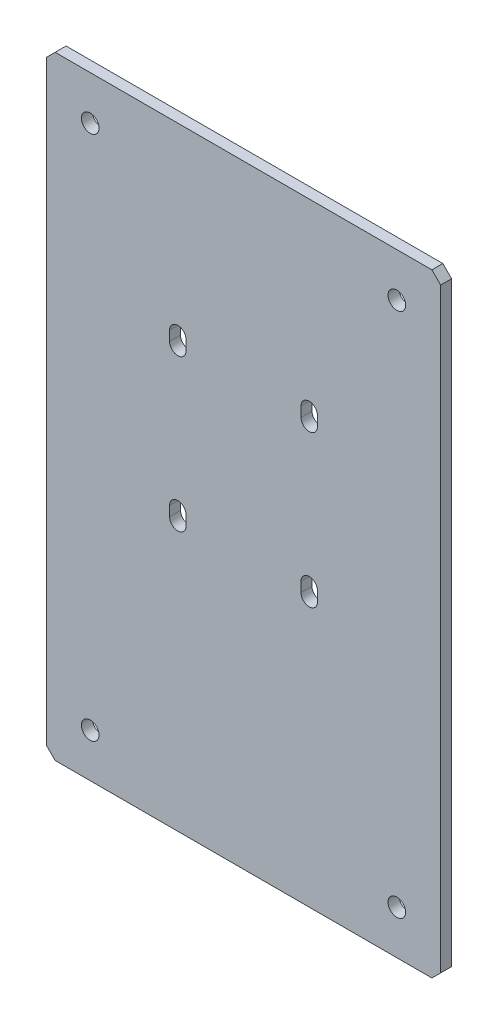
from build123d import *

# Parameters (mm, degrees)
SKETCH1_W              = 114.3
SKETCH1_H              = 177.8
BOSS_EXTRUDE1_DEPTH    = 3.175
CUT_EXTRUDE1_DEPTH     = 212.393970172
F_10_CLEARANCE_HOLE1_D = 5.1054
CHAMFER1_SIZE          = 2.54


with BuildPart() as part:
    # Sketch1 → Boss-Extrude1 (new body)
    with BuildSketch(Plane.XY):
        with Locations((57.15, 88.9)):
            Rectangle(SKETCH1_W, SKETCH1_H)
    extrude(amount=-BOSS_EXTRUDE1_DEPTH)

    # Sketch2 → Cut-Extrude1 (cut, through all)
    with BuildSketch(Plane.XY):
        with BuildLine():
            Line((35.71875, 121.7875), (35.71875, 124.645))
            ThreePointArc((35.71875, 124.645), (38.1, 127.02625), (40.48125, 124.645))
            Line((40.48125, 124.645), (40.48125, 121.7875))
            ThreePointArc((40.48125, 121.7875), (38.1, 119.40625), (35.71875, 121.7875))
        make_face()
        with BuildLine():
            Line((35.71875, 77.7875), (35.71875, 80.645))
            ThreePointArc((35.71875, 80.645), (38.1, 83.02625), (40.48125, 80.645))
            Line((40.48125, 80.645), (40.48125, 77.7875))
            ThreePointArc((40.48125, 77.7875), (38.1, 75.40625), (35.71875, 77.7875))
        make_face()
        with BuildLine():
            Line((78.58125, 121.7875), (78.58125, 124.645))
            ThreePointArc((78.58125, 124.645), (76.2, 127.02625), (73.81875, 124.645))
            Line((73.81875, 124.645), (73.81875, 121.7875))
            ThreePointArc((73.81875, 121.7875), (76.2, 119.40625), (78.58125, 121.7875))
        make_face()
        with BuildLine():
            Line((78.58125, 77.7875), (78.58125, 80.645))
            ThreePointArc((78.58125, 80.645), (76.2, 83.02625), (73.81875, 80.645))
            Line((73.81875, 80.645), (73.81875, 77.7875))
            ThreePointArc((73.81875, 77.7875), (76.2, 75.40625), (78.58125, 77.7875))
        make_face()
    extrude(amount=-CUT_EXTRUDE1_DEPTH, mode=Mode.SUBTRACT)

    # #10 Clearance Hole1 (through all)
    with Locations(Plane.XY):
        with Locations((12.7, 12.7), (12.7, 165.1), (101.6, 165.1), (101.6, 12.7)):
            Hole(F_10_CLEARANCE_HOLE1_D / 2)

    # Chamfer1
    chamfer1_edges = [part.edges().sort_by_distance(p)[0] for p in [
        (0, 0, -1.5875),
        (114.3, 0, -1.5875),
        (114.3, 177.8, -1.5875),
        (0, 177.8, -1.5875),
    ]]
    chamfer(chamfer1_edges, length=CHAMFER1_SIZE)


solid = part.part
